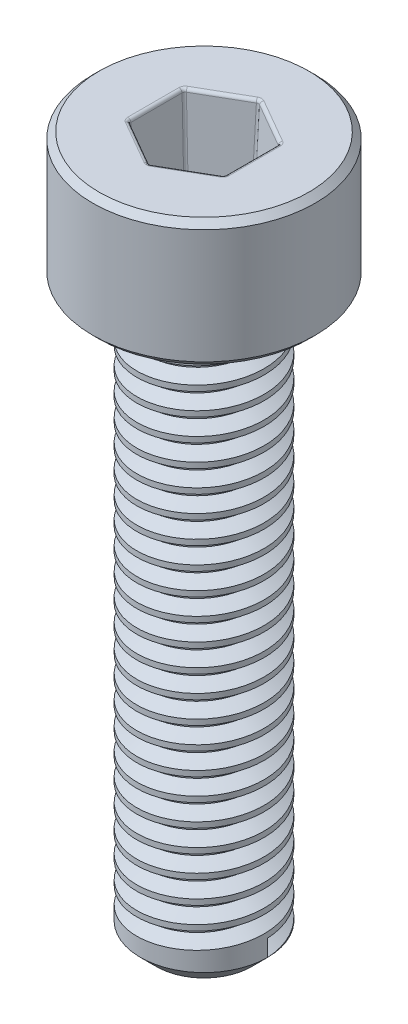
from build123d import *

# Parameters (mm, degrees)
SKETCH_1_R          = 3.5
EXTRUDE_1_DEPTH     = 4
CUT_EXTRUDE_1_DEPTH = 3
CUT_EXTRUDE_1_DRAFT = -3
FILLET_1_R          = 0.1
CHAMFER_1_SIZE      = 0.2
SKETCH_3_R          = 2
EXTRUDE_2_DEPTH     = 18
CHAMFER_2_SIZE      = 0.5
THREAD_1_PITCH      = 0.7


with BuildPart() as part:
    # Sketch 1 → Бобышка-Вытянуть1 (new body)
    with BuildSketch(Plane(origin=(0, 0, 0), x_dir=(1, 0, 0), z_dir=(0, 1, 0))):
        with Locations(Location((0, 0, 0), (0, 0, 270))):
            Circle(SKETCH_1_R)
    extrude(amount=EXTRUDE_1_DEPTH)


with BuildPart() as cut_extrude_1_tool:
    # Эскиз2 → Вырез-Вытянуть1 (with draft: the straight prism first)
    with BuildSketch(Plane(origin=(0, 4, 0), x_dir=(1, 0, 0), z_dir=(0, 1, 0))):
        Polygon((0, 1.732050808), (-1.5, 0.866025404), (-1.5, -0.866025404), (0, -1.732050808), (1.5, -0.866025404), (1.5, 0.866025404), align=None)
    extrude(amount=-CUT_EXTRUDE_1_DEPTH)
    # Вырез-Вытянуть1: the draft: its side faces are tilted about the plane it starts from
    cut_extrude_1_sides = [cut_extrude_1_tool.faces().sort_by_distance(p)[0] for p in [
        (-0.75, 2.5, -1.299038106),
        (-1.5, 2.5, 0),
        (-0.75, 2.5, 1.299038106),
        (0.75, 2.5, 1.299038106),
        (1.5, 2.5, 0),
        (0.75, 2.5, -1.299038106),
    ]]
    draft(cut_extrude_1_sides, Plane(origin=(0, 4, 0), x_dir=(1, 0, 0), z_dir=(0, 1, 0)), CUT_EXTRUDE_1_DRAFT)


with BuildPart() as part_1:
    add(part.part)

    # Вырез-Вытянуть1: cut by cut_extrude_1_tool
    add(cut_extrude_1_tool.part, mode=Mode.SUBTRACT)

    # Скругление1
    fillet_1_edges = [part_1.edges().sort_by_distance(p)[0] for p in [
        (-1.421388331, 2.5, 0.820638936),
        (-0.671388331, 1, -1.162878701),
        (-1.421388331, 2.5, -0.820638936),
        (0.75, 4, -1.299038106),
        (-0.75, 4, -1.299038106),
        (-1.5, 4, 0),
        (-0.75, 4, 1.299038106),
        (0.75, 4, 1.299038106),
        (1.5, 4, 0),
        (0.671388331, 1, -1.162878701),
        (0, 2.5, -1.641277871),
        (1.342776662, 1, 0),
        (1.421388331, 2.5, -0.820638936),
        (0.671388331, 1, 1.162878701),
        (1.421388331, 2.5, 0.820638936),
        (-0.671388331, 1, 1.162878701),
        (0, 2.5, 1.641277871),
        (-1.342776662, 1, 0),
    ]]
    fillet(fillet_1_edges, radius=FILLET_1_R)

    # Фаска1
    chamfer_1_edges = [part_1.edges().sort_by_distance(p)[0] for p in [
        (0, 0, -3.5),
        (0, 4, -3.5),
    ]]
    chamfer(chamfer_1_edges, length=CHAMFER_1_SIZE)

    # Эскиз3 → Бобышка-Вытянуть2 (add)
    with BuildSketch(Plane.XZ):
        with Locations(Location((0, 0, 0), (0, 0, 90))):
            Circle(SKETCH_3_R)
    extrude(amount=EXTRUDE_2_DEPTH)

    # Фаска2
    chamfer_2_edges = [part_1.edges().sort_by_distance(p)[0] for p in [
        (0, -18, -2),
    ]]
    chamfer(chamfer_2_edges, length=CHAMFER_2_SIZE)

    # Резьба1: the profile of Sketch 1 2 profile screwed along a right-hand helix of 25 turns, 6 arcs to a turn; built about Z, then put on its axis
    thread_1_z = Axis((0, 0, 0), (0, 0, 1))
    thread_1_corners = [(2.0003, 0, -0.000173205), (1.621113887, 0, 0.218749999), (1.621113887, 0, 0.306249999), (2.0003, 0, 0.525173203)]
    with BuildLine(mode=Mode.PRIVATE) as thread_1_profile:
        Line(thread_1_corners[0], thread_1_corners[1])
        Line(thread_1_corners[1], thread_1_corners[2])
        Line(thread_1_corners[2], thread_1_corners[3])
        Line(thread_1_corners[3], thread_1_corners[0])
    thread_1_cap = Face(thread_1_profile.wire())
    thread_1_turn_angles = [0, 30, 60, 90, 120, 150, 180, 210, 240, 270, 300, 330, 360]
    thread_1_turn_weights = [1, 0.8660254037844387, 1, 0.8660254037844387, 1, 0.8660254037844387, 1, 0.8660254037844387, 1, 0.8660254037844387, 1, 0.8660254037844387, 1]
    thread_1_turn_rails = [Edge.make_bspline([Vector(p[0], p[1], 0).rotate(thread_1_z, thread_1_turn_angles[k]) / thread_1_turn_weights[k] + Vector(0, 0, p[2] + THREAD_1_PITCH * thread_1_turn_angles[k] / 360) for k in range(13)], [0, 0, 0, 1, 1, 2, 2, 3, 3, 4, 4, 5, 5, 6, 6, 6], 2, thread_1_turn_weights) for p in thread_1_corners]
    thread_1_turn_sides = [Face.make_surface_from_curves(thread_1_turn_rails[p[0]], thread_1_turn_rails[p[1]]) for p in [(0, 1), (1, 2), (2, 3), (3, 0)]]
    thread_1 = Plane(origin=(0, -17.5, 0), x_dir=(1, 0, 0), z_dir=(0, 1, 0)) * Solid(Shell([*[p.moved(Location((0, 0, THREAD_1_PITCH * i))) for i in range(25) for p in thread_1_turn_sides], thread_1_cap, thread_1_cap.rotate(thread_1_z, 9000).moved(Location((0, 0, THREAD_1_PITCH * 9000 / 360)))]))
    add(thread_1, mode=Mode.SUBTRACT)


solid = part_1.part
